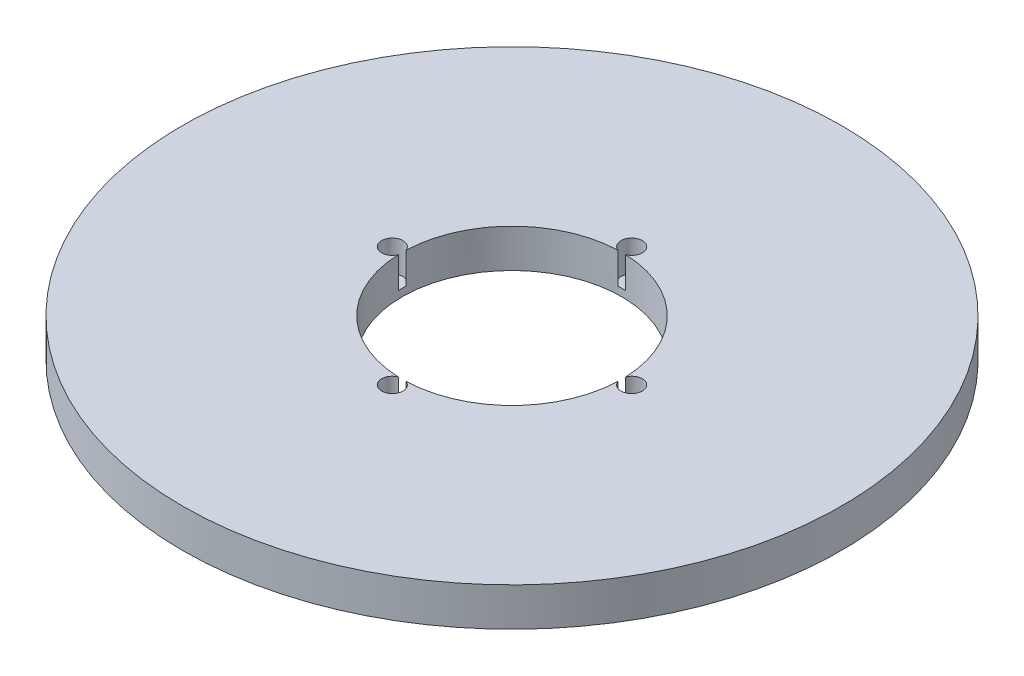
from build123d import *

# Parameters (mm, degrees)
SKETCH1_R           = 60
BOSS_EXTRUDE1_DEPTH = 7
SKETCH2_R           = 20
CUT_EXTRUDE1_DEPTH  = 86.141059425
SKETCH3_R           = 1.938225918
CUT_EXTRUDE2_DEPTH  = 5.67527353
CIRPATTERN1_COUNT   = 4


with BuildPart() as part:
    # Sketch1 → Boss-Extrude1 (new body)
    with BuildSketch(Plane(origin=(0, 0, 0), x_dir=(1, 0, 0), z_dir=(0, 1, 0))):
        Circle(SKETCH1_R)
    extrude(amount=BOSS_EXTRUDE1_DEPTH)

    # Sketch2 → Cut-Extrude1 (cut, through all)
    with BuildSketch(Plane(origin=(0, 0, 0), x_dir=(1, 0, 0), z_dir=(0, 1, 0))):
        Circle(SKETCH2_R)
    extrude(amount=CUT_EXTRUDE1_DEPTH, mode=Mode.SUBTRACT)

    # Sketch3 → Cut-Extrude2 (cut)
    with BuildSketch(Plane(origin=(0, 7, 0), x_dir=(1, 0, 0), z_dir=(0, 1, 0))):
        with Locations((-21.790201222, 0)):
            Circle(SKETCH3_R)
    cut_extrude2 = extrude(amount=-CUT_EXTRUDE2_DEPTH, mode=Mode.SUBTRACT)

    # CirPattern1: Cut-Extrude2 ×4 about axis
    cirpattern1_axis = Axis((0, 0, 0), (0, 1, 0))
    for i in range(1, CIRPATTERN1_COUNT):
        add(cut_extrude2.rotate(cirpattern1_axis, i * 360 / CIRPATTERN1_COUNT), mode=Mode.SUBTRACT)


solid = part.part
